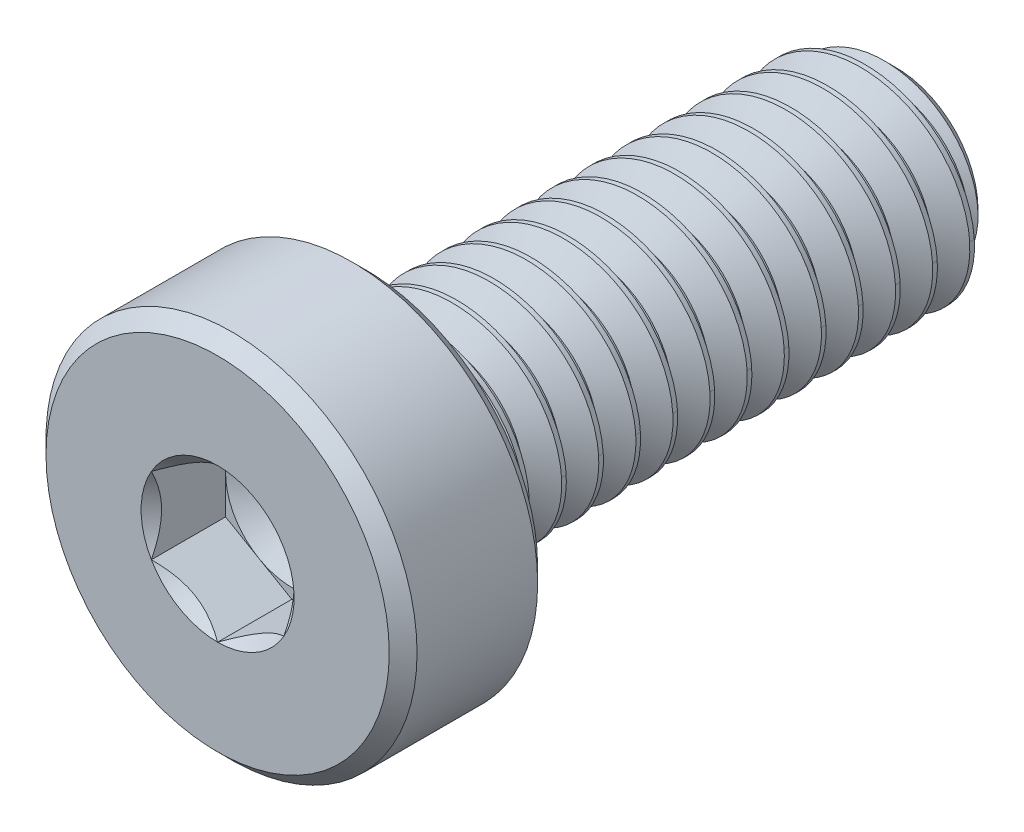
from build123d import *

# Parameters (mm, degrees)
CUT_EXTRUDE1_DEPTH = 1.4
CUT_SWEEP1_PITCH   = 0.7


with BuildPart() as part:
    # Sketch2 → Revolve1 (revolve)
    with BuildSketch(Plane(origin=(0, 0, 0), x_dir=(0, 0, -1), z_dir=(1, 0, 0)), mode=Mode.PRIVATE) as revolve1_sk:
        with BuildLine():
            Line((-3.8625, 3.5), (-3.6, 3.2375))
            Line((-3.6, 3.2375), (-3.6, 2.2))
            ThreePointArc((-3.6, 2.2), (-3.541421356, 2.058578644), (-3.4, 2))
            Line((-3.4, 2), (5.945336663, 2))
            Line((5.945336663, 2), (6.4, 1.545336663))
            Line((6.4, 1.545336663), (6.4, 0))
            Line((6.4, 0), (-5, 0))
            Line((-5, 0), (-5, 1.25))
            Line((-5, 1.25), (-6.4, 1.25))
            Line((-6.4, 1.25), (-6.4, 3.2375))
            Line((-6.4, 3.2375), (-6.1375, 3.5))
            Line((-6.1375, 3.5), (-3.8625, 3.5))
        make_face()
    revolve(revolve1_sk.sketch.rotate(Axis((0, 0, 5), (0, 0, -1)), 90), axis=Axis((0, 0, 5), (0, 0, -1)))

    # Sketch3 → Cut-Extrude1 (cut)
    with BuildSketch(Plane.XY.offset(6.4)):
        Polygon((0, 1.443375673), (-1.25, 0.721687836), (-1.25, -0.721687836), (0, -1.443375673), (1.25, -0.721687836), (1.25, 0.721687836), align=None)
    extrude(amount=-CUT_EXTRUDE1_DEPTH, mode=Mode.SUBTRACT)

    # Cut-Extrude2 cone 1 section (through the dimple's axis) → Cut-Extrude2 (revolve, cut)
    with BuildSketch(Plane(origin=(0, 0, 6.4), x_dir=(0, -1, 0), z_dir=(1, 0, 0))):
        Polygon((0, 0), (1.443375673, 0), (0, 1.443375673), align=None)
    revolve(axis=Axis((0, 0, 6.4), (0, 0, -1)), mode=Mode.SUBTRACT)

    # Cut-Extrude5 cone 1 section (through the dimple's axis) → Cut-Extrude5 (revolve, cut)
    with BuildSketch(Plane(origin=(0, 0, 5), x_dir=(0, -1, 0), z_dir=(1, 0, 0))):
        Polygon((0, 0), (1.25, 0), (0, 0.721687836), align=None)
    revolve(axis=Axis((0, 0, 5), (0, 0, -1)), mode=Mode.SUBTRACT)

    # Cut-Sweep1: the profile of Sketch8 screwed along a right-hand helix of 14.910714 turns, 6 arcs to a turn; built about Z, then put on its axis
    cut_sweep1_z = Axis((0, 0, 0), (0, 0, 1))
    cut_sweep1_corners = [(2.037888611, 0, 0.021875), (2.037888611, 0, -0.634375), (1.545336663, 0, -0.35), (1.545336663, 0, -0.2625)]
    with BuildLine(mode=Mode.PRIVATE) as cut_sweep1_profile:
        Line(cut_sweep1_corners[0], cut_sweep1_corners[1])
        Line(cut_sweep1_corners[1], cut_sweep1_corners[2])
        Line(cut_sweep1_corners[2], cut_sweep1_corners[3])
        Line(cut_sweep1_corners[3], cut_sweep1_corners[0])
    cut_sweep1_cap = Face(cut_sweep1_profile.wire())
    cut_sweep1_turn_angles = [0, 30, 60, 90, 120, 150, 180, 210, 240, 270, 300, 330, 360]
    cut_sweep1_turn_weights = [1, 0.8660254037844387, 1, 0.8660254037844387, 1, 0.8660254037844387, 1, 0.8660254037844387, 1, 0.8660254037844387, 1, 0.8660254037844387, 1]
    cut_sweep1_turn_rails = [Edge.make_bspline([Vector(p[0], p[1], 0).rotate(cut_sweep1_z, cut_sweep1_turn_angles[k]) / cut_sweep1_turn_weights[k] + Vector(0, 0, p[2] + CUT_SWEEP1_PITCH * cut_sweep1_turn_angles[k] / 360) for k in range(13)], [0, 0, 0, 1, 1, 2, 2, 3, 3, 4, 4, 5, 5, 6, 6, 6], 2, cut_sweep1_turn_weights) for p in cut_sweep1_corners]
    cut_sweep1_turn_sides = [Face.make_surface_from_curves(cut_sweep1_turn_rails[p[0]], cut_sweep1_turn_rails[p[1]]) for p in [(0, 1), (1, 2), (2, 3), (3, 0)]]
    cut_sweep1_last_angles = [5040, 5070, 5100, 5130, 5160, 5190, 5220, 5250, 5280, 5310, 5340, 5353.928571429, 5367.857142857]
    cut_sweep1_last_weights = [1, 0.8660254037844387, 1, 0.8660254037844387, 1, 0.8660254037844387, 1, 0.8660254037844387, 1, 0.8660254037844387, 1, 0.9705965674533923, 1]
    cut_sweep1_last_rails = [Edge.make_bspline([Vector(p[0], p[1], 0).rotate(cut_sweep1_z, cut_sweep1_last_angles[k]) / cut_sweep1_last_weights[k] + Vector(0, 0, p[2] + CUT_SWEEP1_PITCH * cut_sweep1_last_angles[k] / 360) for k in range(13)], [0, 0, 0, 1, 1, 2, 2, 3, 3, 4, 4, 5, 5, 6, 6, 6], 2, cut_sweep1_last_weights) for p in cut_sweep1_corners]
    cut_sweep1_last_sides = [Face.make_surface_from_curves(cut_sweep1_last_rails[p[0]], cut_sweep1_last_rails[p[1]]) for p in [(0, 1), (1, 2), (2, 3), (3, 0)]]
    cut_sweep1 = Plane(origin=(0, 0, -6.4), x_dir=(0, 1, 0), z_dir=(0, 0, 1)) * Solid(Shell([*[p.moved(Location((0, 0, CUT_SWEEP1_PITCH * i))) for i in range(14) for p in cut_sweep1_turn_sides], *cut_sweep1_last_sides, cut_sweep1_cap, cut_sweep1_cap.rotate(cut_sweep1_z, 5367.857142857).moved(Location((0, 0, CUT_SWEEP1_PITCH * 5367.857142857 / 360)))]))
    add(cut_sweep1, mode=Mode.SUBTRACT)

    # Sketch9 → Revolve2 (revolve)
    with BuildSketch(Plane(origin=(0, 0, 0), x_dir=(0, 0, -1), z_dir=(1, 0, 0)), mode=Mode.PRIVATE) as revolve2_sk:
        with BuildLine():
            Line((-4.08125, 0), (-4.08125, 2.2))
            Line((-4.08125, 2.2), (-3.6, 2.2))
            ThreePointArc((-3.6, 2.2), (-3.541421356, 2.058578644), (-3.4, 2))
            Line((-3.4, 2), (-2.9, 2))
            Line((-2.9, 2), (-1.745299462, 0))
            Line((-1.745299462, 0), (-4.08125, 0))
        make_face()
    revolve(revolve2_sk.sketch.rotate(Axis((0, 0, 1.745299462), (0, 0, 1)), 270), axis=Axis((0, 0, 1.745299462), (0, 0, 1)))


solid = part.part
